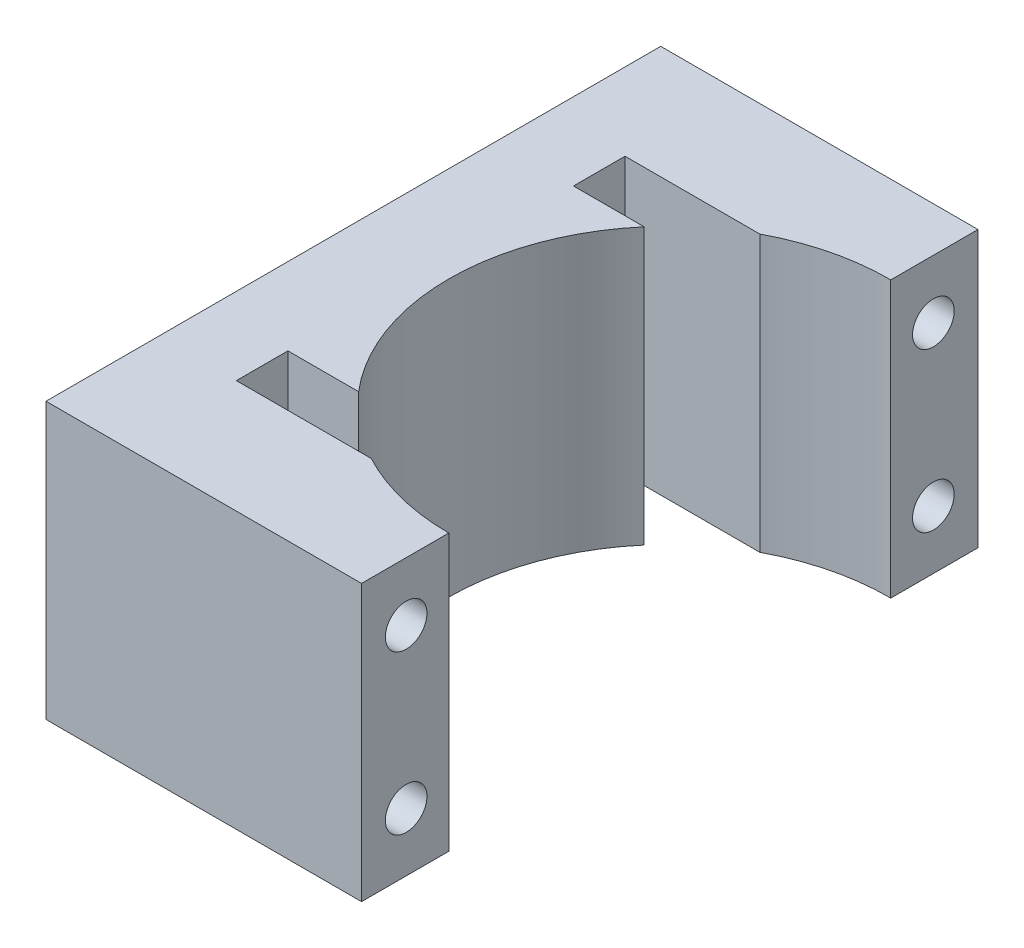
from build123d import *

# Parameters (mm, degrees)
EXTRUDE_1_DEPTH     = 13.9
SKETCH_2_R          = 1.05
CUT_EXTRUDE_1_DEPTH = 38.552762881


with BuildPart() as part:
    # 草图1 → 凸台-拉伸1 (new body)
    with BuildSketch(Plane(origin=(0, 0, 0), x_dir=(1, 0, 0), z_dir=(0, 1, 0))):
        with BuildLine():
            Line((0, 0), (15.912485012, 0))
            Line((15.912485012, 0), (15.912485012, 4.4))
            ThreePointArc((15.912485012, 4.4), (13.226409808, 4.729902507), (10.7, 5.7))
            Line((10.7, 5.7), (3.9, 5.7))
            Line((3.9, 5.7), (3.9, 8.3))
            Line((3.9, 8.3), (7.464408308, 8.3))
            ThreePointArc((7.464408308, 8.3), (4.812485012, 15.5), (7.464408308, 22.7))
            Line((7.464408308, 22.7), (3.9, 22.7))
            Line((3.9, 22.7), (3.9, 25.3))
            Line((3.9, 25.3), (10.7, 25.3))
            ThreePointArc((10.7, 25.3), (13.26888799, 26.28060271), (16, 26.599655))
            Line((16, 26.599655), (16, 31))
            Line((16, 31), (0, 31))
            Line((0, 31), (0, 0))
        make_face()
    extrude(amount=EXTRUDE_1_DEPTH)

    # 草图2 → 切除-拉伸1 (cut, through all)
    with BuildSketch(Plane.ZY):
        with Locations((-28.75, 10.95)):
            Circle(SKETCH_2_R)
        with Locations((-2.25, 10.95)):
            Circle(SKETCH_2_R)
        with Locations((-2.25, 2.95)):
            Circle(SKETCH_2_R)
        with Locations((-28.75, 2.95)):
            Circle(SKETCH_2_R)
    extrude(amount=-CUT_EXTRUDE_1_DEPTH, mode=Mode.SUBTRACT)


solid = part.part
